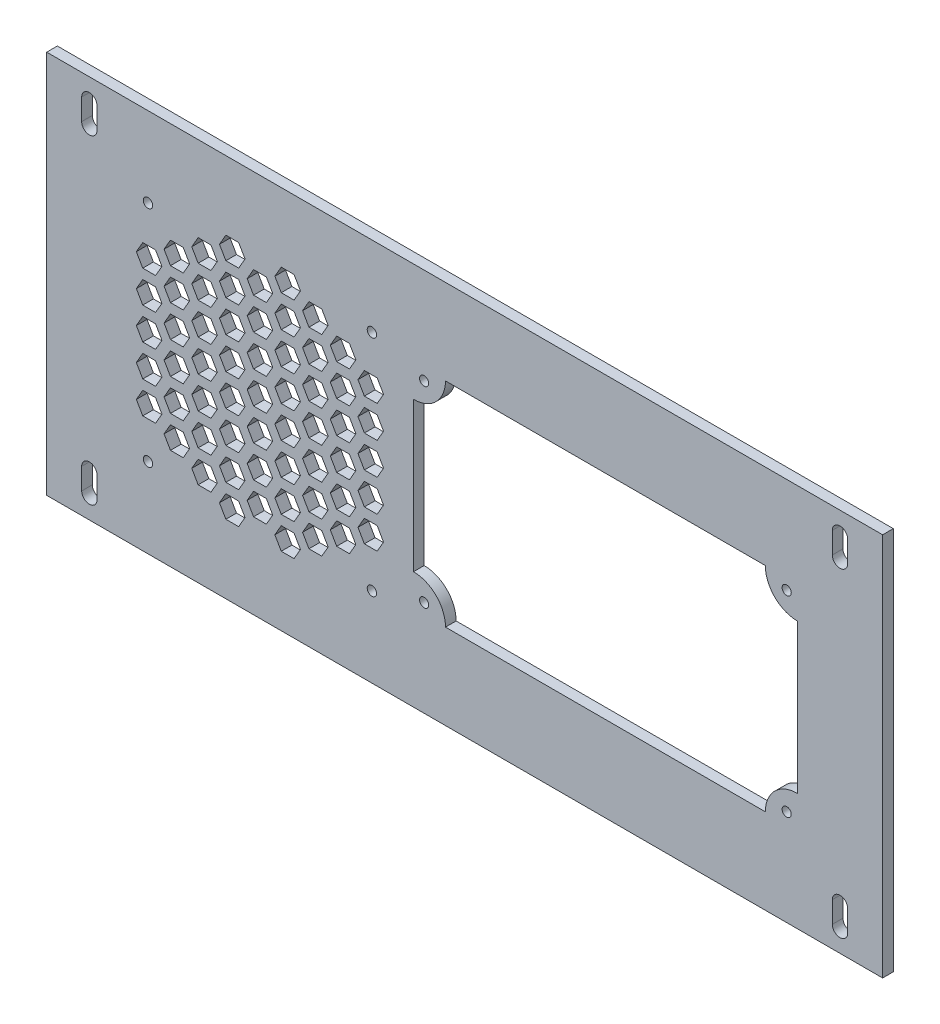
from build123d import *

# Parameters (mm, degrees)
SKETCH1_W                                = 392
SKETCH1_H                                = 180
BOSS_EXTRUDE1_DEPTH                      = 5
CUT_EXTRUDE1_REACH                       = 217.734
SKETCH2_R                                = 2.15
CUT_EXTRUDE2_REACH                       = 217.734
SKETCH4_R                                = 2.2
CUT_EXTRUDE3_REACH                       = 217.734
MIRROR1_AT_THE_SECOND_PLANE_COPY_1_REACH = 217.734
FILL_PATTERN1_DEPTH                      = 5


# Read off the part's stored shape, not the designer's step: Fill Pattern1
with BuildPart() as part:
    # Sketch1 → Boss-Extrude1 (new body)
    with BuildSketch(Plane.XY):
        Rectangle(SKETCH1_W, SKETCH1_H)
    extrude(amount=BOSS_EXTRUDE1_DEPTH)

    # Sketch2 → Cut-Extrude1 (cut, up to next)
    with BuildSketch(Plane.XY.offset(5), mode=Mode.PRIVATE) as cut_extrude1_sk1:
        with Locations((-19, 45)):
            Circle(SKETCH2_R)
    cut_extrude1_tool1 = extrude(cut_extrude1_sk1.sketch, amount=-CUT_EXTRUDE1_REACH, mode=Mode.PRIVATE) & part.part
    # Sketch2 → Cut-Extrude1 (cut, up to next)
    with BuildSketch(Plane.XY.offset(5), mode=Mode.PRIVATE) as cut_extrude1_sk2:
        with Locations((151, 45)):
            Circle(SKETCH2_R)
    cut_extrude1_tool2 = extrude(cut_extrude1_sk2.sketch, amount=-CUT_EXTRUDE1_REACH, mode=Mode.PRIVATE) & part.part
    # Sketch2 → Cut-Extrude1 (cut, up to next)
    with BuildSketch(Plane.XY.offset(5), mode=Mode.PRIVATE) as cut_extrude1_sk3:
        with Locations((151, -45)):
            Circle(SKETCH2_R)
    cut_extrude1_tool3 = extrude(cut_extrude1_sk3.sketch, amount=-CUT_EXTRUDE1_REACH, mode=Mode.PRIVATE) & part.part
    # Sketch2 → Cut-Extrude1 (cut, up to next)
    with BuildSketch(Plane.XY.offset(5), mode=Mode.PRIVATE) as cut_extrude1_sk4:
        with Locations((-19, -45)):
            Circle(SKETCH2_R)
    cut_extrude1_tool4 = extrude(cut_extrude1_sk4.sketch, amount=-CUT_EXTRUDE1_REACH, mode=Mode.PRIVATE) & part.part
    # Sketch2 → Cut-Extrude1 (cut, up to next)
    with BuildSketch(Plane.XY.offset(5), mode=Mode.PRIVATE) as cut_extrude1_sk5:
        with BuildLine():
            Line((-24, 35), (-24, -35))
            ThreePointArc((-24, -35), (-13.393398282, -39.393398282), (-9, -50))
            Line((-9, -50), (141, -50))
            ThreePointArc((141, -50), (145.393398282, -39.393398282), (156, -35))
            Line((156, -35), (156, 35))
            ThreePointArc((156, 35), (145.393398282, 39.393398282), (141, 50))
            Line((141, 50), (-9, 50))
            ThreePointArc((-9, 50), (-13.393398282, 39.393398282), (-24, 35))
        make_face()
    cut_extrude1_tool5 = extrude(cut_extrude1_sk5.sketch, amount=-CUT_EXTRUDE1_REACH, mode=Mode.PRIVATE) & part.part
    add(cut_extrude1_tool1.solids().sort_by_distance((-19, 45, 5))[0], mode=Mode.SUBTRACT)
    add(cut_extrude1_tool2.solids().sort_by_distance((151, 45, 5))[0], mode=Mode.SUBTRACT)
    add(cut_extrude1_tool3.solids().sort_by_distance((151, -45, 5))[0], mode=Mode.SUBTRACT)
    add(cut_extrude1_tool4.solids().sort_by_distance((-19, -45, 5))[0], mode=Mode.SUBTRACT)
    add(cut_extrude1_tool5.solids().sort_by_distance((66, 0, 5))[0], mode=Mode.SUBTRACT)

    # Sketch4 → Cut-Extrude2 (cut, up to next)
    with BuildSketch(Plane.XY.offset(5), mode=Mode.PRIVATE) as cut_extrude2_sk1:
        with Locations((-148.5, 52.5)):
            Circle(SKETCH4_R)
    cut_extrude2_tool1 = extrude(cut_extrude2_sk1.sketch, amount=-CUT_EXTRUDE2_REACH, mode=Mode.PRIVATE) & part.part
    # Sketch4 → Cut-Extrude2 (cut, up to next)
    with BuildSketch(Plane.XY.offset(5), mode=Mode.PRIVATE) as cut_extrude2_sk2:
        with Locations((-43.5, 52.5)):
            Circle(SKETCH4_R)
    cut_extrude2_tool2 = extrude(cut_extrude2_sk2.sketch, amount=-CUT_EXTRUDE2_REACH, mode=Mode.PRIVATE) & part.part
    # Sketch4 → Cut-Extrude2 (cut, up to next)
    with BuildSketch(Plane.XY.offset(5), mode=Mode.PRIVATE) as cut_extrude2_sk3:
        with Locations((-43.5, -52.5)):
            Circle(SKETCH4_R)
    cut_extrude2_tool3 = extrude(cut_extrude2_sk3.sketch, amount=-CUT_EXTRUDE2_REACH, mode=Mode.PRIVATE) & part.part
    # Sketch4 → Cut-Extrude2 (cut, up to next)
    with BuildSketch(Plane.XY.offset(5), mode=Mode.PRIVATE) as cut_extrude2_sk4:
        with Locations((-148.5, -52.5)):
            Circle(SKETCH4_R)
    cut_extrude2_tool4 = extrude(cut_extrude2_sk4.sketch, amount=-CUT_EXTRUDE2_REACH, mode=Mode.PRIVATE) & part.part
    add(cut_extrude2_tool1.solids().sort_by_distance((-148.5, 52.5, 5))[0], mode=Mode.SUBTRACT)
    add(cut_extrude2_tool2.solids().sort_by_distance((-43.5, 52.5, 5))[0], mode=Mode.SUBTRACT)
    add(cut_extrude2_tool3.solids().sort_by_distance((-43.5, -52.5, 5))[0], mode=Mode.SUBTRACT)
    add(cut_extrude2_tool4.solids().sort_by_distance((-148.5, -52.5, 5))[0], mode=Mode.SUBTRACT)

    # Sketch5 → Cut-Extrude3 (cut, up to next)
    with BuildSketch(Plane.XY.offset(5), mode=Mode.PRIVATE) as cut_extrude3_sk1:
        with BuildLine():
            Line((172.4, -80), (172.4, -70))
            ThreePointArc((172.4, -70), (176, -66.4), (179.6, -70))
            Line((179.6, -70), (179.6, -80))
            ThreePointArc((179.6, -80), (176, -83.6), (172.4, -80))
        make_face()
    cut_extrude3_tool1 = extrude(cut_extrude3_sk1.sketch, amount=-CUT_EXTRUDE3_REACH, mode=Mode.PRIVATE) & part.part
    cut_extrude3 = cut_extrude3_tool1.solids().sort_by_distance((176, -75, 5))[0]
    add(cut_extrude3, mode=Mode.SUBTRACT)

    # Mirror1: Cut-Extrude3 across plane
    add(cut_extrude3.mirror(Plane.ZX), mode=Mode.SUBTRACT)

    # Mirror1 at the second plane: Cut-Extrude3 across plane
    add(cut_extrude3.mirror(Plane(origin=(0, 0, 0), x_dir=(0, 0, 1), z_dir=(1, 0, 0))), mode=Mode.SUBTRACT)

    # Mirror1 at the second plane copy 1 sketc → Mirror1 at the second plane copy 1 (cut, up to next)
    with BuildSketch(Plane(origin=(0, 0, 5), x_dir=(-1, 0, 0), z_dir=(0, 0, 1)), mode=Mode.PRIVATE) as mirror1_at_the_second_plane_copy_1_sk1:
        with BuildLine():
            Line((172.4, -80), (172.4, -70))
            ThreePointArc((172.4, -70), (176, -66.4), (179.6, -70))
            Line((179.6, -70), (179.6, -80))
            ThreePointArc((179.6, -80), (176, -83.6), (172.4, -80))
        make_face()
    mirror1_at_the_second_plane_copy_1_tool1 = extrude(mirror1_at_the_second_plane_copy_1_sk1.sketch, amount=-MIRROR1_AT_THE_SECOND_PLANE_COPY_1_REACH, mode=Mode.PRIVATE) & part.part
    add(mirror1_at_the_second_plane_copy_1_tool1.solids().sort_by_distance((-176, 75, 5))[0], mode=Mode.SUBTRACT)

    # Fill Pattern1 outline → Fill Pattern1 (cut)
    with BuildSketch(Plane.XY):
        Polygon((-114.990381057, 52.5), (-111.990381057, 47.303847577), (-105.990381057, 47.303847577), (-102.990381057, 52.5), (-105.990381057, 57.696152423), (-111.990381057, 57.696152423), align=None)
        Polygon((-89.009618943, 7.5), (-86.009618943, 2.303847577), (-80.009618943, 2.303847577), (-77.009618943, 7.5), (-80.009618943, 12.696152423), (-86.009618943, 12.696152423), align=None)
        Polygon((-102, 30), (-99, 24.803847577), (-93, 24.803847577), (-90, 30), (-93, 35.196152423), (-99, 35.196152423), align=None)
        Polygon((-63.02885683, -37.5), (-60.02885683, -42.696152423), (-54.02885683, -42.696152423), (-51.02885683, -37.5), (-54.02885683, -32.303847577), (-60.02885683, -32.303847577), align=None)
        Polygon((-76.019237886, -15), (-73.019237886, -20.196152423), (-67.019237886, -20.196152423), (-64.019237886, -15), (-67.019237886, -9.803847577), (-73.019237886, -9.803847577), align=None)
        Polygon((-86.009618943, 47.303847577), (-80.009618943, 47.303847577), (-77.009618943, 52.5), (-80.009618943, 57.696152423), (-86.009618943, 57.696152423), (-89.009618943, 52.5), align=None)
        Polygon((-131.97114317, 2.303847577), (-128.97114317, 7.5), (-131.97114317, 12.696152423), (-137.97114317, 12.696152423), (-140.97114317, 7.5), (-137.97114317, 2.303847577), align=None)
        Polygon((-144.961524227, -20.196152423), (-141.961524227, -15), (-144.961524227, -9.803847577), (-150.961524227, -9.803847577), (-153.961524227, -15), (-150.961524227, -20.196152423), align=None)
        Polygon((-118.980762114, 24.803847577), (-115.980762114, 30), (-118.980762114, 35.196152423), (-124.980762114, 35.196152423), (-127.980762114, 30), (-124.980762114, 24.803847577), align=None)
        Polygon((-102, -30), (-99, -35.196152423), (-93, -35.196152423), (-90, -30), (-93, -24.803847577), (-99, -24.803847577), align=None)
        Polygon((-114.990381057, -7.5), (-111.990381057, -12.696152423), (-105.990381057, -12.696152423), (-102.990381057, -7.5), (-105.990381057, -2.303847577), (-111.990381057, -2.303847577), align=None)
        Polygon((-89.009618943, -52.5), (-86.009618943, -57.696152423), (-80.009618943, -57.696152423), (-77.009618943, -52.5), (-80.009618943, -47.303847577), (-86.009618943, -47.303847577), align=None)
        Polygon((-127.980762114, 15), (-124.980762114, 9.803847577), (-118.980762114, 9.803847577), (-115.980762114, 15), (-118.980762114, 20.196152423), (-124.980762114, 20.196152423), align=None)
        Polygon((-140.97114317, 37.5), (-137.97114317, 32.303847577), (-131.97114317, 32.303847577), (-128.97114317, 37.5), (-131.97114317, 42.696152423), (-137.97114317, 42.696152423), align=None)
        Polygon((-150.961524227, -35.196152423), (-144.961524227, -35.196152423), (-141.961524227, -30), (-144.961524227, -24.803847577), (-150.961524227, -24.803847577), (-153.961524227, -30), align=None)
        Polygon((-124.980762114, -35.196152423), (-118.980762114, -35.196152423), (-115.980762114, -30), (-118.980762114, -24.803847577), (-124.980762114, -24.803847577), (-127.980762114, -30), align=None)
        Polygon((-47.038475773, -35.196152423), (-41.038475773, -35.196152423), (-38.038475773, -30), (-41.038475773, -24.803847577), (-47.038475773, -24.803847577), (-50.038475773, -30), align=None)
        Polygon((-73.019237886, -35.196152423), (-67.019237886, -35.196152423), (-64.019237886, -30), (-67.019237886, -24.803847577), (-73.019237886, -24.803847577), (-76.019237886, -30), align=None)
        Polygon((-105.990381057, -57.696152423), (-102.990381057, -52.5), (-105.990381057, -47.303847577), (-111.990381057, -47.303847577), (-114.990381057, -52.5), (-111.990381057, -57.696152423), align=None)
        Polygon((-54.02885683, 32.303847577), (-51.02885683, 37.5), (-54.02885683, 42.696152423), (-60.02885683, 42.696152423), (-63.02885683, 37.5), (-60.02885683, 32.303847577), align=None)
        Polygon((-80.009618943, -12.696152423), (-77.009618943, -7.5), (-80.009618943, -2.303847577), (-86.009618943, -2.303847577), (-89.009618943, -7.5), (-86.009618943, -12.696152423), align=None)
        Polygon((-67.019237886, 9.803847577), (-64.019237886, 15), (-67.019237886, 20.196152423), (-73.019237886, 20.196152423), (-76.019237886, 15), (-73.019237886, 9.803847577), align=None)
        Polygon((-102, -45), (-99, -50.196152423), (-93, -50.196152423), (-90, -45), (-93, -39.803847577), (-99, -39.803847577), align=None)
        Polygon((-127.980762114, 0), (-124.980762114, -5.196152423), (-118.980762114, -5.196152423), (-115.980762114, 0), (-118.980762114, 5.196152423), (-124.980762114, 5.196152423), align=None)
        Polygon((-114.990381057, -22.5), (-111.990381057, -27.696152423), (-105.990381057, -27.696152423), (-102.990381057, -22.5), (-105.990381057, -17.303847577), (-111.990381057, -17.303847577), align=None)
        Polygon((-140.97114317, 22.5), (-137.97114317, 17.303847577), (-131.97114317, 17.303847577), (-128.97114317, 22.5), (-131.97114317, 27.696152423), (-137.97114317, 27.696152423), align=None)
        Polygon((-124.980762114, -50.196152423), (-118.980762114, -50.196152423), (-115.980762114, -45), (-118.980762114, -39.803847577), (-124.980762114, -39.803847577), (-127.980762114, -45), align=None)
        Polygon((-73.019237886, -50.196152423), (-67.019237886, -50.196152423), (-64.019237886, -45), (-67.019237886, -39.803847577), (-73.019237886, -39.803847577), (-76.019237886, -45), align=None)
        Polygon((-80.009618943, -27.696152423), (-77.009618943, -22.5), (-80.009618943, -17.303847577), (-86.009618943, -17.303847577), (-89.009618943, -22.5), (-86.009618943, -27.696152423), align=None)
        Polygon((-54.02885683, 17.303847577), (-51.02885683, 22.5), (-54.02885683, 27.696152423), (-60.02885683, 27.696152423), (-63.02885683, 22.5), (-60.02885683, 17.303847577), align=None)
        Polygon((-67.019237886, -5.196152423), (-64.019237886, 0), (-67.019237886, 5.196152423), (-73.019237886, 5.196152423), (-76.019237886, 0), (-73.019237886, -5.196152423), align=None)
        Polygon((-153.961524227, 15), (-150.961524227, 9.803847577), (-144.961524227, 9.803847577), (-141.961524227, 15), (-144.961524227, 20.196152423), (-150.961524227, 20.196152423), align=None)
        Polygon((-140.97114317, -7.5), (-137.97114317, -12.696152423), (-131.97114317, -12.696152423), (-128.97114317, -7.5), (-131.97114317, -2.303847577), (-137.97114317, -2.303847577), align=None)
        Polygon((-47.038475773, 9.803847577), (-41.038475773, 9.803847577), (-38.038475773, 15), (-41.038475773, 20.196152423), (-47.038475773, 20.196152423), (-50.038475773, 15), align=None)
        Polygon((-99, 9.803847577), (-93, 9.803847577), (-90, 15), (-93, 20.196152423), (-99, 20.196152423), (-102, 15), align=None)
        Polygon((-114.990381057, -37.5), (-111.990381057, -42.696152423), (-105.990381057, -42.696152423), (-102.990381057, -37.5), (-105.990381057, -32.303847577), (-111.990381057, -32.303847577), align=None)
        Polygon((-127.980762114, -15), (-124.980762114, -20.196152423), (-118.980762114, -20.196152423), (-115.980762114, -15), (-118.980762114, -9.803847577), (-124.980762114, -9.803847577), align=None)
        Polygon((-153.961524227, 30), (-150.961524227, 24.803847577), (-144.961524227, 24.803847577), (-141.961524227, 30), (-144.961524227, 35.196152423), (-150.961524227, 35.196152423), align=None)
        Polygon((-111.990381057, 2.303847577), (-105.990381057, 2.303847577), (-102.990381057, 7.5), (-105.990381057, 12.696152423), (-111.990381057, 12.696152423), (-114.990381057, 7.5), align=None)
        Polygon((-60.02885683, 2.303847577), (-54.02885683, 2.303847577), (-51.02885683, 7.5), (-54.02885683, 12.696152423), (-60.02885683, 12.696152423), (-63.02885683, 7.5), align=None)
        Polygon((-99, -5.196152423), (-93, -5.196152423), (-90, 0), (-93, 5.196152423), (-99, 5.196152423), (-102, 0), align=None)
        Polygon((-150.961524227, -5.196152423), (-144.961524227, -5.196152423), (-141.961524227, 0), (-144.961524227, 5.196152423), (-150.961524227, 5.196152423), (-153.961524227, 0), align=None)
        Polygon((-47.038475773, -5.196152423), (-41.038475773, -5.196152423), (-38.038475773, 0), (-41.038475773, 5.196152423), (-47.038475773, 5.196152423), (-50.038475773, 0), align=None)
        Polygon((-131.97114317, -27.696152423), (-128.97114317, -22.5), (-131.97114317, -17.303847577), (-137.97114317, -17.303847577), (-140.97114317, -22.5), (-137.97114317, -27.696152423), align=None)
        Polygon((-93, 39.803847577), (-90, 45), (-93, 50.196152423), (-99, 50.196152423), (-102, 45), (-99, 39.803847577), align=None)
        Polygon((-105.990381057, 17.303847577), (-102.990381057, 22.5), (-105.990381057, 27.696152423), (-111.990381057, 27.696152423), (-114.990381057, 22.5), (-111.990381057, 17.303847577), align=None)
        Polygon((-60.02885683, -12.696152423), (-54.02885683, -12.696152423), (-51.02885683, -7.5), (-54.02885683, -2.303847577), (-60.02885683, -2.303847577), (-63.02885683, -7.5), align=None)
        Polygon((-80.009618943, 32.303847577), (-77.009618943, 37.5), (-80.009618943, 42.696152423), (-86.009618943, 42.696152423), (-89.009618943, 37.5), (-86.009618943, 32.303847577), align=None)
        Polygon((-60.02885683, -27.696152423), (-54.02885683, -27.696152423), (-51.02885683, -22.5), (-54.02885683, -17.303847577), (-60.02885683, -17.303847577), (-63.02885683, -22.5), align=None)
        Polygon((-67.019237886, 39.803847577), (-64.019237886, 45), (-67.019237886, 50.196152423), (-73.019237886, 50.196152423), (-76.019237886, 45), (-73.019237886, 39.803847577), align=None)
        Polygon((-80.009618943, 17.303847577), (-77.009618943, 22.5), (-80.009618943, 27.696152423), (-86.009618943, 27.696152423), (-89.009618943, 22.5), (-86.009618943, 17.303847577), align=None)
        Polygon((-86.009618943, -42.696152423), (-80.009618943, -42.696152423), (-77.009618943, -37.5), (-80.009618943, -32.303847577), (-86.009618943, -32.303847577), (-89.009618943, -37.5), align=None)
        Polygon((-137.97114317, -42.696152423), (-131.97114317, -42.696152423), (-128.97114317, -37.5), (-131.97114317, -32.303847577), (-137.97114317, -32.303847577), (-140.97114317, -37.5), align=None)
        Polygon((-93, -20.196152423), (-90, -15), (-93, -9.803847577), (-99, -9.803847577), (-102, -15), (-99, -20.196152423), align=None)
        Polygon((-67.019237886, 24.803847577), (-64.019237886, 30), (-67.019237886, 35.196152423), (-73.019237886, 35.196152423), (-76.019237886, 30), (-73.019237886, 24.803847577), align=None)
        Polygon((-118.980762114, 39.803847577), (-115.980762114, 45), (-118.980762114, 50.196152423), (-124.980762114, 50.196152423), (-127.980762114, 45), (-124.980762114, 39.803847577), align=None)
        Polygon((-41.038475773, 24.803847577), (-38.038475773, 30), (-41.038475773, 35.196152423), (-47.038475773, 35.196152423), (-50.038475773, 30), (-47.038475773, 24.803847577), align=None)
        Polygon((-105.990381057, 32.303847577), (-102.990381057, 37.5), (-105.990381057, 42.696152423), (-111.990381057, 42.696152423), (-114.990381057, 37.5), (-111.990381057, 32.303847577), align=None)
        Polygon((-47.038475773, -20.196152423), (-41.038475773, -20.196152423), (-38.038475773, -15), (-41.038475773, -9.803847577), (-47.038475773, -9.803847577), (-50.038475773, -15), align=None)
    extrude(amount=FILL_PATTERN1_DEPTH, mode=Mode.SUBTRACT)


solid = part.part
